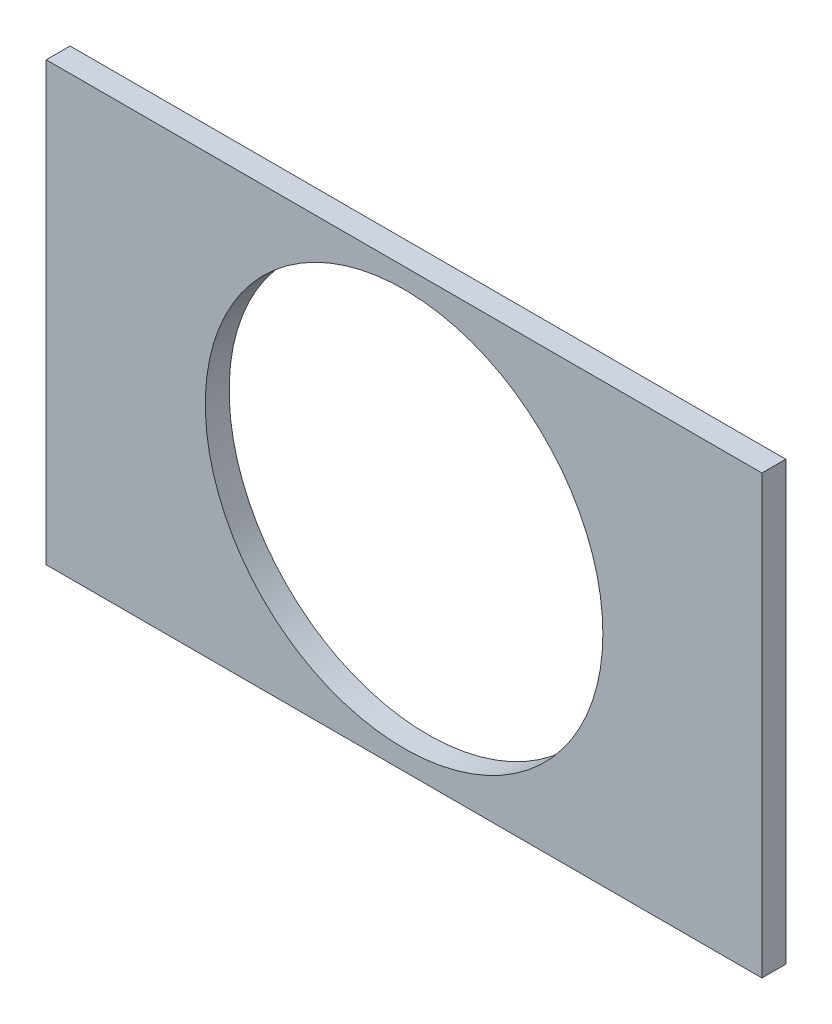
from build123d import *

# Parameters (mm, degrees)
SKETCH1_W           = 180
SKETCH1_H           = 110
BOSS_EXTRUDE1_DEPTH = 6
SKETCH2_R           = 50
CUT_EXTRUDE1_DEPTH  = 6


with BuildPart() as part:
    # Sketch1 → Boss-Extrude1 (new body)
    with BuildSketch(Plane.XY):
        with Locations((90, 55)):
            Rectangle(SKETCH1_W, SKETCH1_H)
    extrude(amount=BOSS_EXTRUDE1_DEPTH)

    # Sketch2 → Cut-Extrude1 (cut)
    with BuildSketch(Plane.XY):
        with Locations((90, 55)):
            Circle(SKETCH2_R)
    extrude(amount=CUT_EXTRUDE1_DEPTH, mode=Mode.SUBTRACT)


solid = part.part
